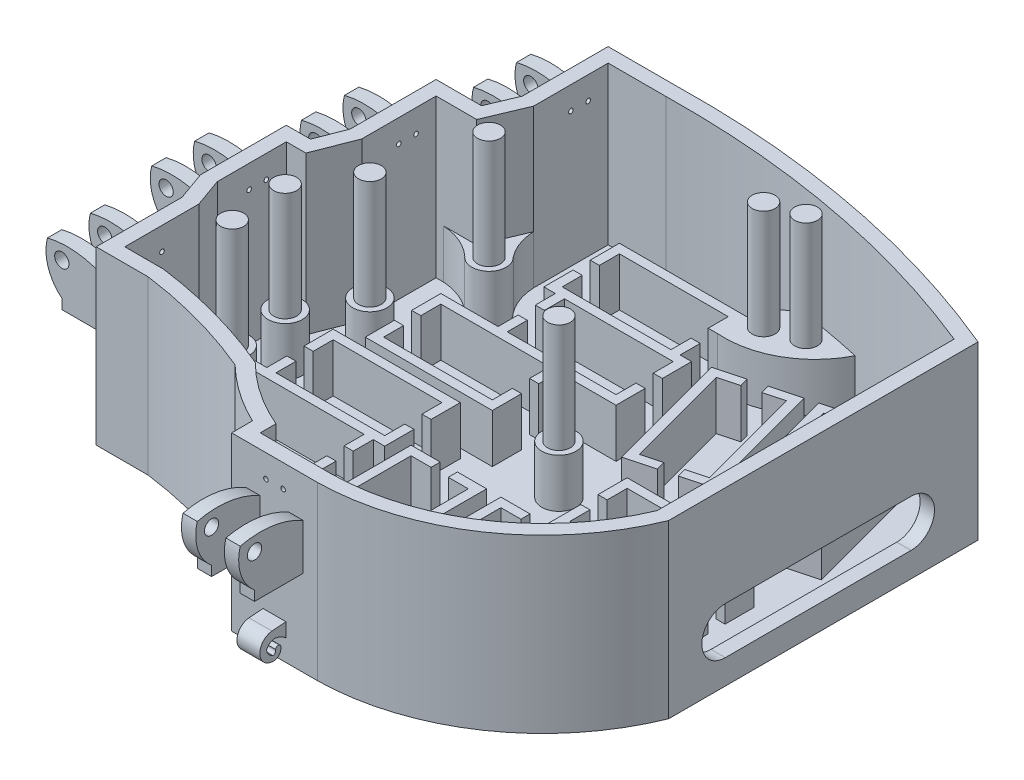
from build123d import *

# Parameters (mm, degrees)
BOSS_EXTRUDE1_DEPTH       = 38.1
CUT_EXTRUDE1_DEPTH        = 34.925
SERVO_BOX_1_DEPTH         = 13.97
SERVO_BOX_2_DEPTH         = 13.97
SERVO_BOX_3_DEPTH         = 13.97
SERVO_BOX_4_DEPTH         = 13.97
SERVO_BOX_5_DEPTH         = 13.97
SERVO_BOX_6_DEPTH         = 13.97
SERVO_BOX_7_DEPTH         = 13.97
SERVO_BOX_8_DEPTH         = 13.97
SERVO_BOX_9_DEPTH         = 13.97
SERVO_BOX_10_DEPTH        = 13.97
SKETCH25_R                = 0.508
THUMB_HOLES_DEPTH         = 15.24
SKETCH31_R                = 0.508
INDEX_FINGER_HOLES_DEPTH  = 20.32
SKETCH32_R                = 0.508
MIDDLE_FINGER_HOLES_DEPTH = 17.78
SKETCH33_R                = 0.508
RING_FINGER_HOLES_DEPTH   = 25.4
SKETCH34_R                = 0.508
PINKY_FINGER_HOLES_DEPTH  = 38.1
SKETCH26_R                = 2.54
GUIDE_POLES_DEPTH         = 36.83
SKETCH35_R                = 1.5875
PINKY_ATTACHMENT_DEPTH    = 19.05
SKETCH36_R                = 1.5875
RING_ATTACHMENT_DEPTH     = 19.05
SKETCH37_R                = 1.5875
MIDDLE_ATTACHMENT_DEPTH   = 19.05
SKETCH38_R                = 1.5875
POINTER_ATTACHMENT_DEPTH  = 19.05
SKETCH39_R                = 1.5875
THUMB_ATTACHMENT_DEPTH    = 19.05
ATTACHMENT_TRIM_DEPTH     = 25.4
CORD_HOLE_DEPTH           = 5.08
PINKY_HOOK_DEPTH          = 19.05
RING_HOOK_DEPTH           = 19.05
MIDDLE_HOOK_DEPTH         = 19.05
POINTER_HOOK_DEPTH        = 19.05
THUMB_HOOK_DEPTH          = 19.05
SKETCH65_W                = 7.179265415
SKETCH65_H                = 11.734441739
SKETCH65_W_2              = 6.985
SKETCH65_H_2              = 14.143697241
SKETCH65_W_3              = 8.606676059
SKETCH65_H_3              = 6.985
SKETCH65_W_4              = 9.07892415
SKETCH65_W_5              = 9.303289173
SKETCH65_W_6              = 8.376543574
SKETCH65_W_7              = 9.735341415
SKETCH65_W_8              = 9.179373228
SKETCH65_W_9              = 9.347822136
CUT_EXTRUDE9_DEPTH        = 13.97
SKETCH67_W                = 6.527750703
SKETCH67_H                = 6.985
CUT_EXTRUDE10_DEPTH       = 12.7
BOSS_EXTRUDE2_START       = 13.97
SKETCH68_W                = 6.477
SKETCH68_H                = 0.951823266
SKETCH68_R                = 3.81
BOSS_EXTRUDE2_DEPTH       = 13.97


with BuildPart() as part:
    # Sketch2 → Boss-Extrude1 (new body)
    with BuildSketch(Plane(origin=(0, 0, 0), x_dir=(1, 0, 0), z_dir=(0, 1, 0))):
        with BuildLine():
            Line((-20.778406205, 52.758673202), (-36.188953289, 52.758673202))
            Line((-36.188953289, 52.758673202), (-36.188953289, 33.708673202))
            Line((-36.188953289, 33.708673202), (-38.864171838, 27.358673202))
            Line((-38.864171838, 27.358673202), (-48.947687906, 27.358673202))
            Line((-48.947687906, 27.358673202), (-48.947687906, 8.308673202))
            Line((-48.947687906, 8.308673202), (-51.417120413, 1.958673202))
            Line((-51.417120413, 1.958673202), (-56.767557511, 1.958673202))
            Line((-56.767557511, 1.958673202), (-56.767557511, -17.091326798))
            Line((-56.767557511, -17.091326798), (-54.503911047, -23.441326798))
            Line((-54.503911047, -23.441326798), (-54.503911047, -42.491326798))
            Line((-54.503911047, -42.491326798), (-42.959403849, -42.491326798))
            ThreePointArc((-42.959403849, -42.491326798), (-29.448791922, -45.239401215), (-16.422067996, -49.755263412))
            ThreePointArc((-16.422067996, -49.755263412), (-10.441569813, -54.6928899), (-3.738179712, -58.593027718))
            Line((-3.738179712, -58.593027718), (-3.738179712, -63.210333869))
            Line((-3.738179712, -63.210333869), (15.311820288, -63.210333869))
            ThreePointArc((15.311820288, -63.210333869), (43.202331698, -54.363191859), (61.572422141, -31.588374066))
            Line((61.572422141, -31.588374066), (61.572422141, 37.055318004))
            ThreePointArc((61.572422141, 37.055318004), (21.220515188, 49.225595088), (-20.778406205, 52.758673202))
        make_face()
    extrude(amount=BOSS_EXTRUDE1_DEPTH)

    # Sketch3 → Cut-Extrude1 (cut)
    with BuildSketch(Plane(origin=(0, 38.1, 0), x_dir=(1, 0, 0), z_dir=(0, 1, 0))):
        with BuildLine():
            Line((-20.159319953, 49.594969273), (-33.013953289, 49.594969273))
            Line((-33.013953289, 49.594969273), (-33.013953289, 33.06717139))
            Line((-33.013953289, 33.06717139), (-36.756520081, 24.183673202))
            Line((-36.756520081, 24.183673202), (-45.772687906, 24.183673202))
            Line((-45.772687906, 24.183673202), (-45.772687906, 7.713042295))
            Line((-45.772687906, 7.713042295), (-49.245203545, -1.216326798))
            Line((-49.245203545, -1.216326798), (-53.592557511, -1.216326798))
            Line((-53.592557511, -1.216326798), (-53.592557511, -16.542334896))
            Line((-53.592557511, -16.542334896), (-51.328911047, -22.892334896))
            Line((-51.328911047, -22.892334896), (-51.328911047, -39.316326798))
            Line((-51.328911047, -39.316326798), (-42.747740567, -39.316326798))
            ThreePointArc((-42.747740567, -39.316326798), (-28.419200466, -42.229621341), (-14.622308527, -47.071121038))
            ThreePointArc((-14.622308527, -47.071121038), (-8.048983539, -52.483535855), (-0.563179712, -56.541315619))
            Line((-0.563179712, -56.541315619), (-0.563179712, -60.035333869))
            Line((-0.563179712, -60.035333869), (15.331165443, -60.035333869))
            ThreePointArc((15.331165443, -60.035333869), (41.184823367, -51.896260365), (58.397422141, -30.958672418))
            Line((58.397422141, -30.958672418), (58.397422141, 34.932598454))
            ThreePointArc((58.397422141, 34.932598454), (19.863190978, 46.250670136), (-20.159319953, 49.594969273))
        make_face()
    extrude(amount=-CUT_EXTRUDE1_DEPTH, mode=Mode.SUBTRACT)

    # Sketch6 → Servo Box 1 (add)
    with BuildSketch(Plane(origin=(0, 0, 0), x_dir=(1, 0, 0), z_dir=(0, 1, 0))):
        Polygon((-39.057888343, -32.914501669), (-37.025888343, -32.914501669), (-37.025888343, -37.359501669), (-12.895888343, -37.359501669), (-12.895888343, -32.914501669), (-10.863888343, -32.914501669), (-10.863888343, -39.391501669), (-39.057888343, -39.391501669), align=None)
        Polygon((-12.895888343, -24.659501669), (-37.025888343, -24.659501669), (-37.025888343, -29.104501669), (-39.057888343, -29.104501669), (-39.057888343, -22.627501669), (-10.863888343, -22.627501669), (-10.863888343, -29.104501669), (-12.895888343, -29.104501669), align=None)
    extrude(amount=SERVO_BOX_1_DEPTH)

    # Sketch7 → Servo Box 2 (add)
    with BuildSketch(Plane(origin=(0, 0, 0), x_dir=(1, 0, 0), z_dir=(0, 1, 0))):
        Polygon((-36.517888343, -18.182501669), (-34.485888343, -18.182501669), (-34.485888343, -22.627501669), (-10.355888343, -22.627501669), (-10.355888343, -18.182501669), (-8.323888343, -18.182501669), (-8.323888343, -24.659501669), (-36.517888343, -24.659501669), align=None)
        Polygon((-10.355888343, -9.927501669), (-34.485888343, -9.927501669), (-34.485888343, -14.372501669), (-36.517888343, -14.372501669), (-36.517888343, -7.895501669), (-8.323888343, -7.895501669), (-8.323888343, -14.372501669), (-10.355888343, -14.372501669), align=None)
    extrude(amount=SERVO_BOX_2_DEPTH)

    # Sketch15 → Servo Box 3 (add)
    with BuildSketch(Plane.XZ):
        Polygon((-31.437888343, -4.423498331), (-29.405888343, -4.423498331), (-29.405888343, -8.868498331), (-5.275888343, -8.868498331), (-5.275888343, -4.423498331), (-3.243888343, -4.423498331), (-3.243888343, -10.900498331), (-31.437888343, -10.900498331), align=None)
        Polygon((-5.275888343, 3.831501669), (-29.405888343, 3.831501669), (-29.405888343, -0.613498331), (-31.437888343, -0.613498331), (-31.437888343, 5.863501669), (-3.243888343, 5.863501669), (-3.243888343, -0.613498331), (-5.275888343, -0.613498331), align=None)
    extrude(amount=-SERVO_BOX_3_DEPTH)

    # Sketch16 → Servo Box 4 (add)
    with BuildSketch(Plane.XZ):
        Polygon((-18.737888343, -19.155498331), (-16.705888343, -19.155498331), (-16.705888343, -23.600498331), (7.424111657, -23.600498331), (7.424111657, -19.155498331), (9.456111657, -19.155498331), (9.456111657, -25.632498331), (-18.737888343, -25.632498331), align=None)
        Polygon((7.424111657, -10.900498331), (-16.705888343, -10.900498331), (-16.705888343, -15.345498331), (-18.737888343, -15.345498331), (-18.737888343, -8.868498331), (9.456111657, -8.868498331), (9.456111657, -15.345498331), (7.424111657, -15.345498331), align=None)
    extrude(amount=-SERVO_BOX_4_DEPTH)

    # Sketch17 → Servo Box 5 (add)
    with BuildSketch(Plane.XZ):
        Polygon((-21.277888343, -33.887498331), (-19.245888343, -33.887498331), (-19.245888343, -38.332498331), (4.884111657, -38.332498331), (4.884111657, -33.887498331), (6.916111657, -33.887498331), (6.916111657, -40.364498331), (-21.277888343, -40.364498331), align=None)
        Polygon((4.884111657, -25.632498331), (-19.245888343, -25.632498331), (-19.245888343, -30.077498331), (-21.277888343, -30.077498331), (-21.277888343, -23.600498331), (6.916111657, -23.600498331), (6.916111657, -30.077498331), (4.884111657, -30.077498331), align=None)
    extrude(amount=-SERVO_BOX_5_DEPTH)

    # Sketch18 → Servo Box 6 (add)
    with BuildSketch(Plane.XZ):
        Polygon((0.880167732, 49.741324935), (0.880167732, 47.709324935), (-3.564832268, 47.709324935), (-3.564832268, 23.579324935), (0.880167732, 23.579324935), (0.880167732, 21.547324935), (-5.596832268, 21.547324935), (-5.596832268, 49.741324935), align=None)
        Polygon((9.135167732, 23.579324935), (9.135167732, 47.709324935), (4.690167732, 47.709324935), (4.690167732, 49.741324935), (11.167167732, 49.741324935), (11.167167732, 21.547324935), (4.690167732, 21.547324935), (4.690167732, 23.579324935), align=None)
    extrude(amount=-SERVO_BOX_6_DEPTH)

    # Sketch19 → Servo Box 7 (add)
    with BuildSketch(Plane.XZ):
        Polygon((20.819167732, 49.741324935), (20.819167732, 47.709324935), (16.374167732, 47.709324935), (16.374167732, 23.579324935), (20.819167732, 23.579324935), (20.819167732, 21.547324935), (14.342167732, 21.547324935), (14.342167732, 49.741324935), align=None)
        Polygon((29.074167732, 23.579324935), (29.074167732, 47.709324935), (24.629167732, 47.709324935), (24.629167732, 49.741324935), (31.106167732, 49.741324935), (31.106167732, 21.547324935), (24.629167732, 21.547324935), (24.629167732, 23.579324935), align=None)
    extrude(amount=-SERVO_BOX_7_DEPTH)

    # Sketch20 → Servo Box 8 (add)
    with BuildSketch(Plane.XZ):
        Polygon((24.629167732, 10.308501669), (26.661167732, 10.308501669), (26.661167732, 5.863501669), (50.791167732, 5.863501669), (50.791167732, 10.308501669), (52.823167732, 10.308501669), (52.823167732, 3.831501669), (24.629167732, 3.831501669), align=None)
        Polygon((50.791167732, 18.563501669), (26.661167732, 18.563501669), (26.661167732, 14.118501669), (24.629167732, 14.118501669), (24.629167732, 20.595501669), (52.823167732, 20.595501669), (52.823167732, 14.118501669), (50.791167732, 14.118501669), align=None)
    extrude(amount=-SERVO_BOX_8_DEPTH)

    # Sketch21 → Servo Box 9 (add)
    with BuildSketch(Plane.XZ):
        Polygon((22.676806499, -29.42649034), (23.202726799, -27.463729061), (27.496267097, -28.614179716), (33.741570655, -5.306389528), (29.448030357, -4.155938872), (29.973950657, -2.193177593), (36.230252234, -3.869548548), (28.933108076, -31.102861295), align=None)
        Polygon((21.474312661, -2.019387655), (15.229009103, -25.327177843), (19.522549401, -26.477628499), (18.996629101, -28.440389778), (12.740327524, -26.764018823), (20.037471682, 0.469293924), (26.293773259, -1.207077031), (25.767852959, -3.16983831), align=None)
    extrude(amount=-SERVO_BOX_9_DEPTH)

    # Sketch22 → Servo Box 10 (add)
    with BuildSketch(Plane.XZ):
        Polygon((41.44571123, -34.455603205), (41.971631529, -32.492841926), (46.265171827, -33.643292581), (52.510475386, -10.335502393), (48.216935088, -9.185051738), (48.742855387, -7.222290459), (54.999156964, -8.898661414), (47.702012807, -36.13197416), align=None)
        Polygon((40.243217392, -7.04850052), (33.997913833, -30.356290709), (38.291454131, -31.506741364), (37.765533832, -33.469502643), (31.509232255, -31.793131688), (38.806376412, -4.559818942), (45.062677989, -6.236189897), (44.53675769, -8.198951176), align=None)
    extrude(amount=-SERVO_BOX_10_DEPTH)

    # Sketch25 → Thumb Holes (cut)
    with BuildSketch(Plane.XY.offset(63.5)):
        with Locations((7.691820288, 33.02)):
            Circle(SKETCH25_R)
        with Locations((3.881820288, 33.02)):
            Circle(SKETCH25_R)
    extrude(amount=-THUMB_HOLES_DEPTH, mode=Mode.SUBTRACT)

    # Sketch31 → Index Finger Holes (cut)
    with BuildSketch(Plane(origin=(-69.85, 0, 0), x_dir=(0, 0, -1), z_dir=(1, 0, 0))):
        with Locations((-31.061326798, 33.02)):
            Circle(SKETCH31_R)
        with Locations((-34.871326798, 33.02)):
            Circle(SKETCH31_R)
    extrude(amount=INDEX_FINGER_HOLES_DEPTH, mode=Mode.SUBTRACT)

    # Sketch32 → Middle Finger Holes (cut)
    with BuildSketch(Plane(origin=(-69.85, 0, 0), x_dir=(0, 0, -1), z_dir=(1, 0, 0))):
        with Locations((-9.471326798, 33.02)):
            Circle(SKETCH32_R)
        with Locations((-5.661326798, 33.02)):
            Circle(SKETCH32_R)
    extrude(amount=MIDDLE_FINGER_HOLES_DEPTH, mode=Mode.SUBTRACT)

    # Sketch33 → Ring Finger Holes (cut)
    with BuildSketch(Plane(origin=(-69.85, 0, 0), x_dir=(0, 0, -1), z_dir=(1, 0, 0))):
        with Locations((15.928673202, 33.02)):
            Circle(SKETCH33_R)
        with Locations((19.738673202, 33.02)):
            Circle(SKETCH33_R)
    extrude(amount=RING_FINGER_HOLES_DEPTH, mode=Mode.SUBTRACT)

    # Sketch34 → Pinky Finger Holes (cut)
    with BuildSketch(Plane(origin=(-69.85, 0, 0), x_dir=(0, 0, -1), z_dir=(1, 0, 0))):
        with Locations((41.328673202, 33.02)):
            Circle(SKETCH34_R)
        with Locations((45.181435651, 33.02)):
            Circle(SKETCH34_R)
    extrude(amount=PINKY_FINGER_HOLES_DEPTH, mode=Mode.SUBTRACT)

    # Sketch26 → Guide Poles (add)
    with BuildSketch(Plane(origin=(0, 38.1, 0), x_dir=(1, 0, 0), z_dir=(0, 1, 0))):
        with Locations((17.870391617, 42.608859806)):
            Circle(SKETCH26_R)
        with Locations((10.89203106, 40.172976619)):
            Circle(SKETCH26_R)
        with Locations((-45.613911047, -9.45946696)):
            Circle(SKETCH26_R)
        with Locations((-44.615018688, -22.199274818)):
            Circle(SKETCH26_R)
        with Locations((-38.480256327, 2.200998331)):
            Circle(SKETCH26_R)
        with Locations((-33.046983998, 23.19417141)):
            Circle(SKETCH26_R)
        with Locations((10.048089446, -4.37946696)):
            Circle(SKETCH26_R)
    extrude(amount=-GUIDE_POLES_DEPTH)

    # Sketch35 → Pinky Attachment (add)
    with BuildSketch(Plane(origin=(0, 0, -52.758673202), x_dir=(-1, 0, 0), z_dir=(0, 0, -1))):
        with BuildLine():
            Line((36.188953289, 19.05), (40.633953289, 19.05))
            Line((40.633953289, 19.05), (46.983953289, 19.05))
            Line((46.983953289, 19.05), (46.983953289, 21.249207691))
            ThreePointArc((46.983953289, 21.249207691), (50.046648442, 25.776891551), (50.158953289, 31.242))
            ThreePointArc((50.158953289, 31.242), (42.978780551, 31.567812574), (36.188953289, 29.21))
            Line((36.188953289, 29.21), (36.188953289, 19.05))
        make_face()
        with Locations((46.983953289, 28.575)):
            Circle(SKETCH35_R, mode=Mode.SUBTRACT)
    extrude(amount=-PINKY_ATTACHMENT_DEPTH)

    # Sketch36 → Ring Attachment (add)
    with BuildSketch(Plane(origin=(0, 0, -27.358673202), x_dir=(-1, 0, 0), z_dir=(0, 0, -1))):
        with BuildLine():
            Line((48.947687906, 29.21), (48.947687906, 19.05))
            Line((48.947687906, 19.05), (53.392687906, 19.05))
            Line((53.392687906, 19.05), (59.742687906, 19.05))
            Line((59.742687906, 19.05), (59.742687906, 21.249207691))
            ThreePointArc((59.742687906, 21.249207691), (62.80538306, 25.776891551), (62.917687906, 31.242))
            ThreePointArc((62.917687906, 31.242), (55.737515168, 31.567812574), (48.947687906, 29.21))
        make_face()
        with Locations((59.742687906, 28.707395517)):
            Circle(SKETCH36_R, mode=Mode.SUBTRACT)
    extrude(amount=-RING_ATTACHMENT_DEPTH)

    # Sketch37 → Middle Attachment (add)
    with BuildSketch(Plane(origin=(0, 0, -1.958673202), x_dir=(-1, 0, 0), z_dir=(0, 0, -1))):
        with BuildLine():
            Line((56.767557511, 29.21), (56.767557511, 19.05))
            Line((56.767557511, 19.05), (61.212557511, 19.05))
            Line((61.212557511, 19.05), (67.562557511, 19.05))
            Line((67.562557511, 19.05), (67.562557511, 21.249207691))
            ThreePointArc((67.562557511, 21.249207691), (70.625252665, 25.776891551), (70.737557511, 31.242))
            ThreePointArc((70.737557511, 31.242), (63.557384773, 31.567812574), (56.767557511, 29.21))
        make_face()
        with Locations((67.562557511, 28.575)):
            Circle(SKETCH37_R, mode=Mode.SUBTRACT)
    extrude(amount=-MIDDLE_ATTACHMENT_DEPTH)

    # Sketch38 → Pointer Attachment (add)
    with BuildSketch(Plane(origin=(0, 0, 23.441326798), x_dir=(-1, 0, 0), z_dir=(0, 0, -1))):
        with BuildLine():
            Line((54.503911047, 29.21), (54.503911047, 19.05))
            Line((54.503911047, 19.05), (65.298911047, 19.05))
            Line((65.298911047, 19.05), (65.298911047, 21.249207691))
            ThreePointArc((65.298911047, 21.249207691), (68.3616062, 25.776891551), (68.473911047, 31.242))
            ThreePointArc((68.473911047, 31.242), (61.293738309, 31.567812574), (54.503911047, 29.21))
        make_face()
        with Locations((65.298911047, 28.575)):
            Circle(SKETCH38_R, mode=Mode.SUBTRACT)
    extrude(amount=-POINTER_ATTACHMENT_DEPTH)

    # Sketch39 → Thumb Attachment (add)
    with BuildSketch(Plane.ZY.offset(3.738179712)):
        with BuildLine():
            Line((63.210333869, 19.05), (67.655333869, 19.05))
            Line((67.655333869, 19.05), (74.005333869, 19.05))
            Line((74.005333869, 19.05), (74.005333869, 21.249207691))
            ThreePointArc((74.005333869, 21.249207691), (77.068029022, 25.776891551), (77.180333869, 31.242))
            ThreePointArc((77.180333869, 31.242), (70.000161131, 31.567812574), (63.210333869, 29.21))
            Line((63.210333869, 29.21), (63.210333869, 19.05))
        make_face()
        with Locations((74.005333869, 28.575)):
            Circle(SKETCH39_R, mode=Mode.SUBTRACT)
    extrude(amount=-THUMB_ATTACHMENT_DEPTH)

    # Sketch40 → Attachment Trim (cut)
    with BuildSketch(Plane(origin=(0, 38.1, 0), x_dir=(1, 0, 0), z_dir=(0, 1, 0))):
        with BuildLine():
            Line((2.611820288, -63.210333869), (8.961820288, -63.210333869))
            Line((8.961820288, -63.210333869), (8.961820288, -80.196396356))
            Line((8.961820288, -80.196396356), (12.136820288, -80.196396356))
            Line((12.136820288, -80.196396356), (12.136820288, -63.210333869))
            Line((12.136820288, -63.210333869), (15.311820288, -63.210333869))
            ThreePointArc((15.311820288, -63.210333869), (4.445704746, -85.500344062), (-6.420410797, -63.210333869))
            Line((-6.420410797, -63.210333869), (-0.563179712, -63.210333869))
            Line((-0.563179712, -63.210333869), (-0.563179712, -80.139154797))
            Line((-0.563179712, -80.139154797), (2.611820288, -80.139154797))
            Line((2.611820288, -80.139154797), (2.611820288, -63.210333869))
        make_face()
        with BuildLine():
            Line((-54.503911047, -42.491326798), (-54.503911047, -39.316326798))
            Line((-54.503911047, -39.316326798), (-69.450746427, -39.316326798))
            Line((-69.450746427, -39.316326798), (-69.450746427, -36.141326798))
            Line((-69.450746427, -36.141326798), (-54.503911047, -36.141326798))
            Line((-54.503911047, -36.141326798), (-54.503911047, -29.791326798))
            Line((-54.503911047, -29.791326798), (-69.522821924, -29.791326798))
            Line((-69.522821924, -29.791326798), (-69.522821924, -26.616326798))
            Line((-69.522821924, -26.616326798), (-54.503911047, -26.616326798))
            Line((-54.503911047, -26.616326798), (-54.503911047, -23.441326798))
            ThreePointArc((-54.503911047, -23.441326798), (-74.827366982, -32.966326798), (-54.503911047, -42.491326798))
        make_face()
        with BuildLine():
            Line((-56.767557511, -17.091326798), (-56.767557511, -13.916326798))
            Line((-56.767557511, -13.916326798), (-71.425044096, -13.916326798))
            Line((-71.425044096, -13.916326798), (-71.425044096, -10.741326798))
            Line((-71.425044096, -10.741326798), (-56.767557511, -10.741326798))
            Line((-56.767557511, -10.741326798), (-56.767557511, -4.391326798))
            Line((-56.767557511, -4.391326798), (-71.300395146, -4.391326798))
            Line((-71.300395146, -4.391326798), (-71.300395146, -1.216326798))
            Line((-71.300395146, -1.216326798), (-56.767557511, -1.216326798))
            Line((-56.767557511, -1.216326798), (-56.767557511, 1.958673202))
            ThreePointArc((-56.767557511, 1.958673202), (-78.393851178, -7.566326798), (-56.767557511, -17.091326798))
        make_face()
        with BuildLine():
            Line((-48.947687906, 8.308673202), (-48.947687906, 11.483673202))
            Line((-48.947687906, 11.483673202), (-65.361733155, 11.483673202))
            Line((-65.361733155, 11.483673202), (-65.361733155, 14.658673202))
            Line((-65.361733155, 14.658673202), (-48.947687906, 14.658673202))
            Line((-48.947687906, 14.658673202), (-48.947687906, 21.008673202))
            Line((-48.947687906, 21.008673202), (-65.776264763, 21.008673202))
            Line((-65.776264763, 21.008673202), (-65.776264763, 24.183673202))
            Line((-65.776264763, 24.183673202), (-48.947687906, 24.183673202))
            Line((-48.947687906, 24.183673202), (-48.947687906, 27.358673202))
            ThreePointArc((-48.947687906, 27.358673202), (-69.447688873, 17.833673202), (-48.947687906, 8.308673202))
        make_face()
        with BuildLine():
            Line((-36.188953289, 33.708673202), (-36.188953289, 36.883673202))
            Line((-36.188953289, 36.883673202), (-51.878710413, 36.883673202))
            Line((-51.878710413, 36.883673202), (-51.878710413, 40.058673202))
            Line((-51.878710413, 40.058673202), (-36.188953289, 40.058673202))
            Line((-36.188953289, 40.058673202), (-36.188953289, 46.408673202))
            Line((-36.188953289, 46.408673202), (-51.739164497, 46.408673202))
            Line((-51.739164497, 46.408673202), (-51.739164497, 49.583673202))
            Line((-51.739164497, 49.583673202), (-36.188953289, 49.583673202))
            Line((-36.188953289, 49.583673202), (-36.188953289, 52.758673202))
            ThreePointArc((-36.188953289, 52.758673202), (-55.79651108, 43.233673202), (-36.188953289, 33.708673202))
        make_face()
    extrude(amount=-ATTACHMENT_TRIM_DEPTH, mode=Mode.SUBTRACT)

    # Sketch41 → Cord Hole (cut)
    with BuildSketch(Plane(origin=(62.913848002, 0, 0), x_dir=(0, 0, -1), z_dir=(1, 0, 0))):
        with BuildLine():
            Line((-19.01291879, 15.851932983), (22.200875308, 15.851932983))
            ThreePointArc((22.200875308, 15.851932983), (27.393164329, 10.659643963), (22.200875308, 5.467354942))
            Line((22.200875308, 5.467354942), (-19.01291879, 5.467354942))
            ThreePointArc((-19.01291879, 5.467354942), (-24.20520781, 10.659643963), (-19.01291879, 15.851932983))
        make_face()
    extrude(amount=-CORD_HOLE_DEPTH, mode=Mode.SUBTRACT)

    # Sketch46 → Pinky Hook (add)
    with BuildSketch(Plane(origin=(0, 0, -52.758673202), x_dir=(-1, 0, 0), z_dir=(0, 0, -1))):
        with BuildLine():
            Line((39.320683194, 7.621451585), (36.188953289, 7.844386781))
            Line((36.188953289, 7.844386781), (36.188953289, 4.727373148))
            ThreePointArc((36.188953289, 4.727373148), (37.395858185, 5.539708243), (38.803288572, 5.908011706))
            ThreePointArc((38.803288572, 5.908011706), (39.836428255, 5.452128522), (40.50065973, 4.53889053))
            ThreePointArc((40.50065973, 4.53889053), (40.049983963, 3.480924447), (39.11676048, 2.808990811))
            ThreePointArc((39.11676048, 2.808990811), (38.578958496, 3.098239074), (38.521895151, 3.706218766))
            ThreePointArc((38.521895151, 3.706218766), (37.766306557, 4.156825411), (37.315699912, 3.401236817))
            ThreePointArc((37.315699912, 3.401236817), (37.762326467, 2.174866491), (38.960755391, 1.657925907))
            ThreePointArc((38.960755391, 1.657925907), (41.260340672, 2.6862265), (41.958380525, 5.10660559))
            ThreePointArc((41.958380525, 5.10660559), (41.06690295, 6.812276944), (39.320683194, 7.621451585))
        make_face()
    extrude(amount=-PINKY_HOOK_DEPTH)

    # Sketch52 → Ring Hook (add)
    with BuildSketch(Plane(origin=(0, 0, -27.358673202), x_dir=(-1, 0, 0), z_dir=(0, 0, -1))):
        with BuildLine():
            Line((52.079417812, 7.621451585), (48.947687906, 7.844386781))
            Line((48.947687906, 7.844386781), (48.947687906, 4.727373148))
            ThreePointArc((48.947687906, 4.727373148), (50.154592803, 5.539708243), (51.56202319, 5.908011706))
            ThreePointArc((51.56202319, 5.908011706), (52.595162873, 5.452128522), (53.259394348, 4.53889053))
            ThreePointArc((53.259394348, 4.53889053), (52.80871858, 3.480924447), (51.875495098, 2.808990811))
            ThreePointArc((51.875495098, 2.808990811), (51.337693114, 3.098239074), (51.280629769, 3.706218766))
            ThreePointArc((51.280629769, 3.706218766), (50.525041175, 4.156825411), (50.07443453, 3.401236817))
            ThreePointArc((50.07443453, 3.401236817), (50.521061084, 2.174866491), (51.719490009, 1.657925907))
            ThreePointArc((51.719490009, 1.657925907), (54.01907529, 2.6862265), (54.717115143, 5.10660559))
            ThreePointArc((54.717115143, 5.10660559), (53.825637568, 6.812276944), (52.079417812, 7.621451585))
        make_face()
    extrude(amount=-RING_HOOK_DEPTH)

    # Sketch59 → Pointer Hook (add)
    with BuildSketch(Plane(origin=(0, 0, 23.441326798), x_dir=(-1, 0, 0), z_dir=(0, 0, -1))):
        with BuildLine():
            Line((57.635640952, 7.621451585), (54.503911047, 7.844386781))
            Line((54.503911047, 7.844386781), (54.503911047, 4.727373148))
            ThreePointArc((54.503911047, 4.727373148), (55.710815943, 5.539708243), (57.11824633, 5.908011706))
            ThreePointArc((57.11824633, 5.908011706), (58.151386013, 5.452128522), (58.815617488, 4.53889053))
            ThreePointArc((58.815617488, 4.53889053), (58.36494172, 3.480924447), (57.431718238, 2.808990811))
            ThreePointArc((57.431718238, 2.808990811), (56.893916254, 3.098239074), (56.836852909, 3.706218766))
            ThreePointArc((56.836852909, 3.706218766), (56.081264315, 4.156825411), (55.63065767, 3.401236817))
            ThreePointArc((55.63065767, 3.401236817), (56.077284225, 2.174866491), (57.275713149, 1.657925907))
            ThreePointArc((57.275713149, 1.657925907), (59.57529843, 2.6862265), (60.273338283, 5.10660559))
            ThreePointArc((60.273338283, 5.10660559), (59.381860708, 6.812276944), (57.635640952, 7.621451585))
        make_face()
    extrude(amount=-POINTER_HOOK_DEPTH)

    # Sketch63 → Thumb Hook (add)
    with BuildSketch(Plane.ZY.offset(3.738179712)):
        with BuildLine():
            Line((66.342063774, 7.621451585), (63.210333869, 7.844386781))
            Line((63.210333869, 7.844386781), (63.210333869, 4.727373148))
            ThreePointArc((63.210333869, 4.727373148), (64.417238765, 5.539708243), (65.824669152, 5.908011706))
            ThreePointArc((65.824669152, 5.908011706), (66.857808836, 5.452128522), (67.52204031, 4.53889053))
            ThreePointArc((67.52204031, 4.53889053), (67.071364543, 3.480924447), (66.13814106, 2.808990811))
            ThreePointArc((66.13814106, 2.808990811), (65.600339076, 3.098239074), (65.543275731, 3.706218766))
            ThreePointArc((65.543275731, 3.706218766), (64.787687137, 4.156825411), (64.337080492, 3.401236817))
            ThreePointArc((64.337080492, 3.401236817), (64.783707047, 2.174866491), (65.982135972, 1.657925907))
            ThreePointArc((65.982135972, 1.657925907), (68.281721252, 2.6862265), (68.979761106, 5.10660559))
            ThreePointArc((68.979761106, 5.10660559), (68.08828353, 6.812276944), (66.342063774, 7.621451585))
        make_face()
    extrude(amount=-THUMB_HOOK_DEPTH)

    # Sketch65 → Cut-Extrude9 (cut)
    with BuildSketch(Plane(origin=(0, 0, 0), x_dir=(1, 0, 0), z_dir=(0, 1, 0))):
        with Locations((-0.342812419, -69.077554738)):
            Rectangle(SKETCH65_W, SKETCH65_H)
        with Locations((11.819320288, -70.28218249)):
            Rectangle(SKETCH65_W_2, SKETCH65_H_2)
        with Locations((-58.807249076, -38.998826798)):
            Rectangle(SKETCH65_W_3, SKETCH65_H_3)
        with Locations((-59.043373122, -26.933826798)):
            Rectangle(SKETCH65_W_4, SKETCH65_H_3)
        with Locations((-53.599332493, 23.866173202)):
            Rectangle(SKETCH65_W_5, SKETCH65_H_3)
        with Locations((-53.135959693, 11.801173202)):
            Rectangle(SKETCH65_W_6, SKETCH65_H_3)
        with Locations((-41.056623997, 49.266173202)):
            Rectangle(SKETCH65_W_7, SKETCH65_H_3)
        with Locations((-40.778639903, 37.201173202)):
            Rectangle(SKETCH65_W_8, SKETCH65_H_3)
        with Locations((-61.441468579, -1.533826798)):
            Rectangle(SKETCH65_W_9, SKETCH65_H_3)
        with Locations((-61.441468579, -13.598826798)):
            Rectangle(SKETCH65_W_9, SKETCH65_H_3)
    extrude(amount=CUT_EXTRUDE9_DEPTH, mode=Mode.SUBTRACT)

    # Sketch68 → Boss-Extrude2 (add)
    with BuildSketch(Plane(origin=(0, 0, 0), x_dir=(1, 0, 0), z_dir=(0, 1, 0)).offset(BOSS_EXTRUDE2_START)):
        with BuildLine():
            Line((-36.756520081, 24.183673202), (-44.116624394, 24.183673202))
            ThreePointArc((-44.116624394, 24.183673202), (-39.750110285, 23.159047878), (-35.968091452, 20.748106971))
            ThreePointArc((-35.968091452, 20.748106971), (-30.41955994, 20.435051475), (-30.461090843, 25.992252287))
            ThreePointArc((-30.461090843, 25.992252287), (-32.282567868, 29.333041468), (-33.013953289, 33.06717139))
            Line((-33.013953289, 33.06717139), (-36.756520081, 24.183673202))
        make_face()
        with BuildLine():
            Line((6.916111657, 40.364498331), (6.916111657, 33.887498331))
            ThreePointArc((6.916111657, 33.887498331), (18.369698214, 36.420736194), (26.475498792, 44.900001261))
            ThreePointArc((26.475498792, 44.900001261), (19.795664978, 46.263261585), (13.073025315, 47.396740505))
            ThreePointArc((13.073025315, 47.396740505), (8.879588598, 44.856813742), (6.916111657, 40.364498331))
        make_face()
        with Locations((27.867667732, -21.071413302)):
            Rectangle(SKETCH68_W, SKETCH68_H)
        with Locations((-38.480256327, 2.200998331)):
            Circle(SKETCH68_R)
        with Locations((-45.613911047, -9.45946696)):
            Circle(SKETCH68_R)
        with Locations((-44.615018688, -22.199274818)):
            Circle(SKETCH68_R)
        with Locations((10.048089446, -4.37946696)):
            Circle(SKETCH68_R)
    extrude(amount=-BOSS_EXTRUDE2_DEPTH)


with BuildPart() as body_2:
    # Sketch56 → Middle Hook (new body)
    with BuildSketch(Plane(origin=(0, 0, -1.958673202), x_dir=(-1, 0, 0), z_dir=(0, 0, -1))):
        with BuildLine():
            Line((59.899287416, 7.621451585), (56.767557511, 7.844386781))
            Line((56.767557511, 7.844386781), (56.767557511, 4.727373148))
            ThreePointArc((56.767557511, 4.727373148), (57.974462407, 5.539708243), (59.381892795, 5.908011706))
            ThreePointArc((59.381892795, 5.908011706), (60.415032478, 5.452128522), (61.079263953, 4.53889053))
            ThreePointArc((61.079263953, 4.53889053), (60.628588185, 3.480924447), (59.695364702, 2.808990811))
            ThreePointArc((59.695364702, 2.808990811), (59.157562718, 3.098239074), (59.100499373, 3.706218766))
            ThreePointArc((59.100499373, 3.706218766), (58.344910779, 4.156825411), (57.894304135, 3.401236817))
            ThreePointArc((57.894304135, 3.401236817), (58.340930689, 2.174866491), (59.539359614, 1.657925907))
            ThreePointArc((59.539359614, 1.657925907), (61.838944894, 2.6862265), (62.536984748, 5.10660559))
            ThreePointArc((62.536984748, 5.10660559), (61.645507173, 6.812276944), (59.899287416, 7.621451585))
        make_face()
    extrude(amount=-MIDDLE_HOOK_DEPTH)

    # Sketch67 → Cut-Extrude10 (cut)
    with BuildSketch(Plane(origin=(0, 0, 0), x_dir=(1, 0, 0), z_dir=(0, 1, 0))):
        with Locations((-60.031432863, -13.598826798)):
            Rectangle(SKETCH67_W, SKETCH67_H)
        with Locations((-60.031432863, -1.533826798)):
            Rectangle(SKETCH67_W, SKETCH67_H)
    extrude(amount=CUT_EXTRUDE10_DEPTH, mode=Mode.SUBTRACT)


solid = Compound([part.part, body_2.part])
